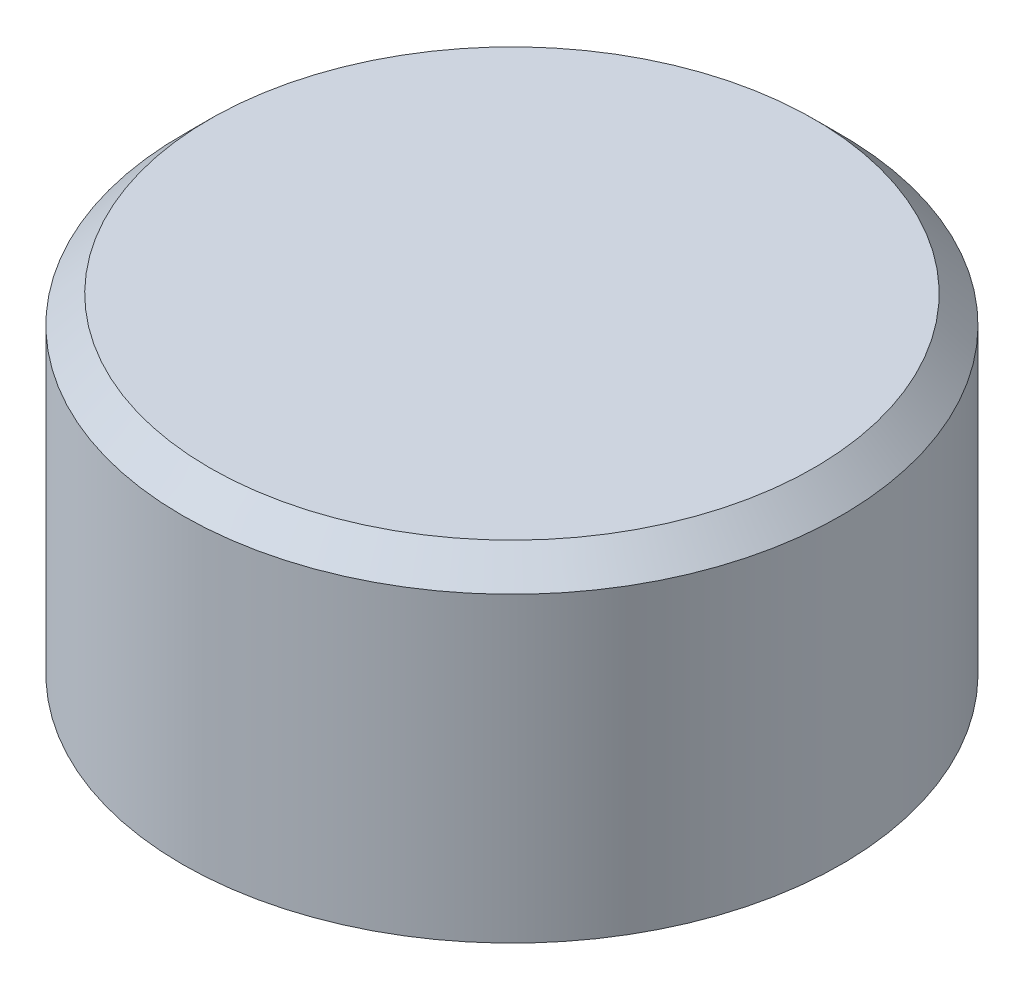
from build123d import *

# Parameters (mm, degrees)
SKETCH1_R           = 6
BOSS_EXTRUDE1_DEPTH = 6
SKETCH2_R           = 2.75
CUT_EXTRUDE1_DEPTH  = 5
CHAMFER1_SIZE       = 0.5
THREAD1_PITCH       = 1
CHAMFER2_SIZE       = 0.5


with BuildPart() as part:
    # Sketch1 → Boss-Extrude1 (new body)
    with BuildSketch(Plane(origin=(0, 0, 0), x_dir=(1, 0, 0), z_dir=(0, 1, 0))):
        with Locations(Location((0, 0, 0), (0, 0, 270))):
            Circle(SKETCH1_R)
    extrude(amount=BOSS_EXTRUDE1_DEPTH)

    # Sketch2 → Cut-Extrude1 (cut)
    with BuildSketch(Plane.XZ):
        with Locations(Location((0, 0, 0), (0, 0, 270))):
            Circle(SKETCH2_R)
    extrude(amount=-CUT_EXTRUDE1_DEPTH, mode=Mode.SUBTRACT)

    # Chamfer1
    chamfer1_edges = [part.edges().sort_by_distance(p)[0] for p in [
        (0, 0, 2.75),
    ]]
    chamfer(chamfer1_edges, length=CHAMFER1_SIZE)

    # Thread1: the profile of Thread Profile1 profile screwed along a right-hand helix of 5.5 turns, 8 arcs to a turn; built about Z, then put on its axis
    thread1_z = Axis((0, 0, 0), (0, 0, 1))
    thread1_corners = [(2.7497, 0, -0.000173205), (3.291265875, 0, 0.312499999), (3.291265875, 0, 0.437499999), (2.7497, 0, 0.750173202)]
    with BuildLine(mode=Mode.PRIVATE) as thread1_profile:
        Line(thread1_corners[0], thread1_corners[1])
        Line(thread1_corners[1], thread1_corners[2])
        Line(thread1_corners[2], thread1_corners[3])
        Line(thread1_corners[3], thread1_corners[0])
    thread1_cap = Face(thread1_profile.wire())
    thread1_turn_angles = [0, 22.5, 45, 67.5, 90, 112.5, 135, 157.5, 180, 202.5, 225, 247.5, 270, 292.5, 315, 337.5, 360]
    thread1_turn_weights = [1, 0.9238795325112867, 1, 0.9238795325112867, 1, 0.9238795325112867, 1, 0.9238795325112867, 1, 0.9238795325112867, 1, 0.9238795325112867, 1, 0.9238795325112867, 1, 0.9238795325112867, 1]
    thread1_turn_rails = [Edge.make_bspline([Vector(p[0], p[1], 0).rotate(thread1_z, thread1_turn_angles[k]) / thread1_turn_weights[k] + Vector(0, 0, p[2] + THREAD1_PITCH * thread1_turn_angles[k] / 360) for k in range(17)], [0, 0, 0, 1, 1, 2, 2, 3, 3, 4, 4, 5, 5, 6, 6, 7, 7, 8, 8, 8], 2, thread1_turn_weights) for p in thread1_corners]
    thread1_turn_sides = [Face.make_surface_from_curves(thread1_turn_rails[p[0]], thread1_turn_rails[p[1]]) for p in [(0, 1), (1, 2), (2, 3), (3, 0)]]
    thread1_last_angles = [1800, 1822.5, 1845, 1867.5, 1890, 1912.5, 1935, 1957.5, 1980]
    thread1_last_weights = [1, 0.9238795325112867, 1, 0.9238795325112867, 1, 0.9238795325112867, 1, 0.9238795325112822, 1]
    thread1_last_rails = [Edge.make_bspline([Vector(p[0], p[1], 0).rotate(thread1_z, thread1_last_angles[k]) / thread1_last_weights[k] + Vector(0, 0, p[2] + THREAD1_PITCH * thread1_last_angles[k] / 360) for k in range(9)], [0, 0, 0, 1, 1, 2, 2, 3, 3, 4, 4, 4], 2, thread1_last_weights) for p in thread1_corners]
    thread1_last_sides = [Face.make_surface_from_curves(thread1_last_rails[p[0]], thread1_last_rails[p[1]]) for p in [(0, 1), (1, 2), (2, 3), (3, 0)]]
    thread1 = Plane(origin=(0, -0.5, 0), x_dir=(1, 0, 0), z_dir=(0, 1, 0)) * Solid(Shell([*[p.moved(Location((0, 0, THREAD1_PITCH * i))) for i in range(5) for p in thread1_turn_sides], *thread1_last_sides, thread1_cap, thread1_cap.rotate(thread1_z, 1980).moved(Location((0, 0, THREAD1_PITCH * 1980 / 360)))]))
    add(thread1, mode=Mode.SUBTRACT)

    # Chamfer2
    chamfer2_edges = [part.edges().sort_by_distance(p)[0] for p in [
        (0, 6, -6),
    ]]
    chamfer(chamfer2_edges, length=CHAMFER2_SIZE)


solid = part.part
